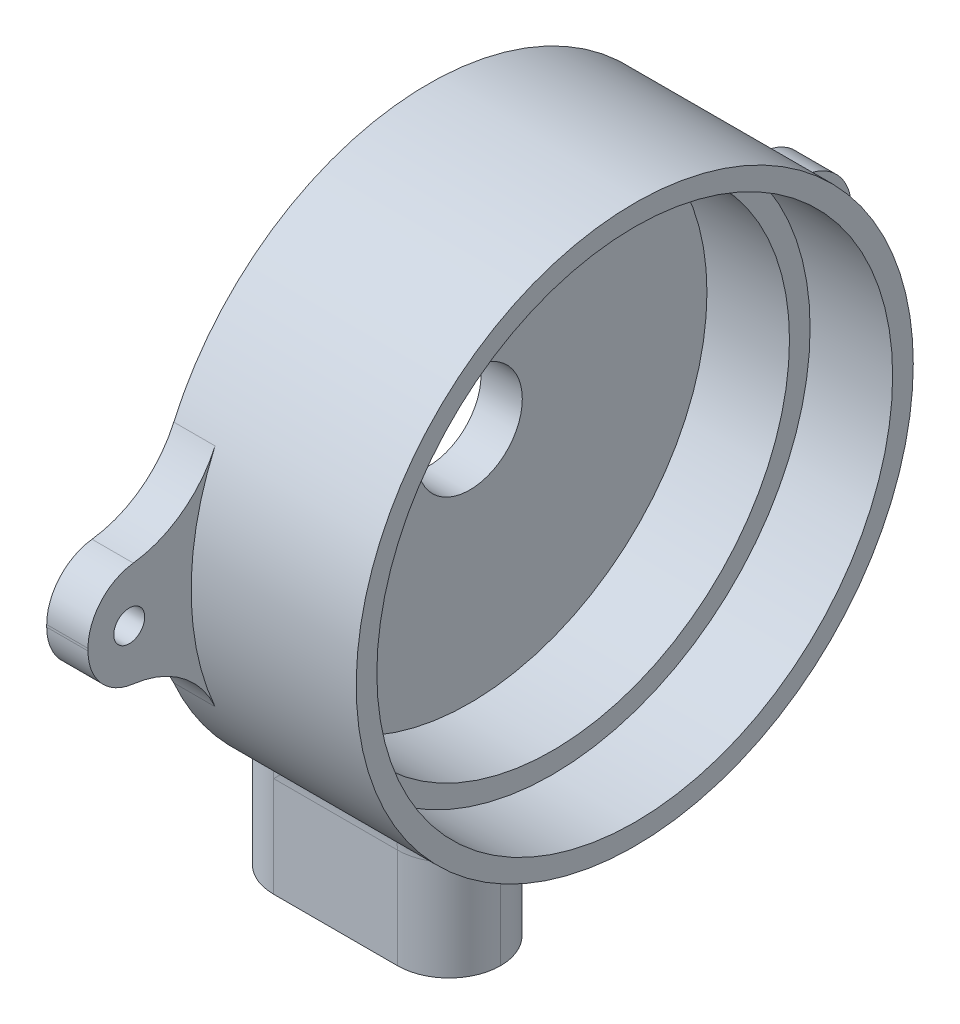
from build123d import *

# Parameters (mm, degrees)
SKETCH_1_R          = 27
EXTRUDE_1_DEPTH     = 20
EXTRUDE_2_DEPTH     = 4
SKETCH_2_R          = 25
CUT_EXTRUDE_1_DEPTH = 8
SKETCH_3_R          = 23
CUT_EXTRUDE_2_DEPTH = 8
CUT_EXTRUDE_5_REACH = 50.518
SKETCH_8_R          = 5.1
CUT_EXTRUDE_6_REACH = 50.518
SKETCH_11_R         = 1.5
FILLET_1_R          = 10
FILLET_2_R          = 5
SKETCH_12_W         = 10
SKETCH_12_H         = 5
EXTRUDE_3_DEPTH     = 15
SKETCH_13_W         = 22
SKETCH_13_H         = 10
EXTRUDE_4_DEPTH     = 17
FILLET_3_R          = 10
FILLET_START        = -21.532998323
FILLET_4_DEPTH      = 0.497094834
FILLET_START_2      = -21.035903489
FILLET_4_2_DEPTH    = 12.502905266
FILLET_START_3      = -37
FILLET_4_3_DEPTH    = 74
FILLET_START_4      = -5
FILLET_4_4_DEPTH    = 10
CUT_EXTRUDE_7_REACH = 84.121
SKETCH_14_R         = 3
FILLET_5_R          = 5


with BuildPart() as part:
    # 草图1 → 凸台-拉伸1 (new body)
    with BuildSketch(Plane(origin=(0, 0, 0), x_dir=(0, 0, -1), z_dir=(1, 0, 0))):
        Circle(SKETCH_1_R)
    extrude(amount=EXTRUDE_1_DEPTH)

    # 草图10 → 凸台-拉伸2 (add)
    with BuildSketch(Plane.ZY):
        Polygon((0, 5), (37, 5), (37, -5), (0, -5), (-37, -5), (-37, 5), align=None)
    extrude(amount=-EXTRUDE_2_DEPTH)

    # 草图2 → 切除-拉伸1 (cut)
    with BuildSketch(Plane(origin=(20, 0, 0), x_dir=(0, 0, -1), z_dir=(1, 0, 0))):
        Circle(SKETCH_2_R)
    extrude(amount=-CUT_EXTRUDE_1_DEPTH, mode=Mode.SUBTRACT)

    # 草图3 → 切除-拉伸2 (cut)
    with BuildSketch(Plane(origin=(12, 0, 0), x_dir=(0, 0, -1), z_dir=(1, 0, 0))):
        Circle(SKETCH_3_R)
    extrude(amount=-CUT_EXTRUDE_2_DEPTH, mode=Mode.SUBTRACT)

    # 草图8 → 切除-拉伸5 (cut, up to next)
    with BuildSketch(Plane(origin=(4, 0, 0), x_dir=(0, 0, -1), z_dir=(1, 0, 0)), mode=Mode.PRIVATE) as cut_extrude_5_sk1:
        Circle(SKETCH_8_R)
    cut_extrude_5_tool1 = extrude(cut_extrude_5_sk1.sketch, amount=-CUT_EXTRUDE_5_REACH, mode=Mode.PRIVATE) & part.part
    add(cut_extrude_5_tool1.solids().sort_by_distance((4, 0, 0))[0], mode=Mode.SUBTRACT)

    # 草图11 → 切除-拉伸6 (cut, up to next)
    with BuildSketch(Plane(origin=(4, 0, 0), x_dir=(0, 0, -1), z_dir=(1, 0, 0)), mode=Mode.PRIVATE) as cut_extrude_6_sk1:
        with Locations((-33, 0)):
            Circle(SKETCH_11_R)
    cut_extrude_6_tool1 = extrude(cut_extrude_6_sk1.sketch, amount=-CUT_EXTRUDE_6_REACH, mode=Mode.PRIVATE) & part.part
    # 草图11 → 切除-拉伸6 (cut, up to next)
    with BuildSketch(Plane(origin=(4, 0, 0), x_dir=(0, 0, -1), z_dir=(1, 0, 0)), mode=Mode.PRIVATE) as cut_extrude_6_sk2:
        with Locations((33, 0)):
            Circle(SKETCH_11_R)
    cut_extrude_6_tool2 = extrude(cut_extrude_6_sk2.sketch, amount=-CUT_EXTRUDE_6_REACH, mode=Mode.PRIVATE) & part.part
    add(cut_extrude_6_tool1.solids().sort_by_distance((4, 0, 33))[0], mode=Mode.SUBTRACT)
    add(cut_extrude_6_tool2.solids().sort_by_distance((4, 0, -33))[0], mode=Mode.SUBTRACT)

    # 圆角1
    fillet_1_edges = [part.edges().sort_by_distance(p)[0] for p in [
        (2, 5, -26.532998323),
        (2, 5, 26.532998323),
        (2, -5, 26.532998323),
        (2, -5, -26.532998323),
    ]]
    fillet(fillet_1_edges, radius=FILLET_1_R)

    # 圆角2
    fillet_2_edges = [part.edges().sort_by_distance(p)[0] for p in [
        (2, 5, 37),
        (2, -5, 37),
        (2, -5, -37),
        (2, 5, -37),
    ]]
    fillet(fillet_2_edges, radius=FILLET_2_R)

    # 草图12 → 凸台-拉伸3 (add)
    with BuildSketch(Plane.ZY):
        with Locations((0, -24.032998323)):
            Rectangle(SKETCH_12_W, SKETCH_12_H)
    extrude(amount=EXTRUDE_3_DEPTH)

    # 草图13 → 凸台-拉伸4 (add)
    with BuildSketch(Plane.XZ.offset(26.532998323)):
        with Locations((-4, 0)):
            Rectangle(SKETCH_13_W, SKETCH_13_H)
    extrude(amount=EXTRUDE_4_DEPTH)

    # 圆角3
    fillet_3_edges = [part.edges().sort_by_distance(p)[0] for p in [
        (0, -24.032998323, -5),
        (0, -24.032998323, 5),
        (3.5, -26.532998323, -5),
        (3.5, -26.532998323, 5),
    ]]
    fillet(fillet_3_edges, radius=FILLET_3_R)

    # 圆角4: read off the stored shape, not the designer's step
    # 圆角4 outline → 圆角4 (add)
    with BuildSketch(Plane(origin=(0, 0, 0), x_dir=(1, 0, 0), z_dir=(0, 1, 0)).offset(FILLET_START)):
        with BuildLine():
            Line((0, -15), (0, -5))
            Line((0, -5), (-10, -5))
            ThreePointArc((-10, -5), (-2.928932188, -7.928932188), (0, -15))
        make_face()
        with BuildLine():
            ThreePointArc((0, 15), (-2.928932188, 7.928932188), (-10, 5))
            Line((-10, 5), (0, 5))
            Line((0, 5), (0, 15))
        make_face()
    extrude(amount=FILLET_4_DEPTH)

    # Fillet 4 2 outline → Fillet 4 2 (add)
    with BuildSketch(Plane(origin=(0, 0, 0), x_dir=(1, 0, 0), z_dir=(0, 1, 0)).offset(FILLET_START_2)):
        with BuildLine():
            Line((0, -15), (0, -5))
            Line((0, -5), (-10, -5))
            ThreePointArc((-10, -5), (-2.928932188, -7.928932188), (0, -15))
        make_face()
        with BuildLine():
            ThreePointArc((0, 15), (-2.928932188, 7.928932188), (-10, 5))
            Line((-10, 5), (0, 5))
            Line((0, 5), (0, 15))
        make_face()
    extrude(amount=FILLET_4_2_DEPTH)

    # Fillet 4 3 outline → Fillet 4 3 (cut)
    with BuildSketch(Plane.XY.offset(FILLET_START_3)):
        with BuildLine():
            Line((-15, -21.532998323), (-13, -21.532998323))
            add(Edge.make_bspline(
                [(-13, -21.532998323), (0, -21.532998323), (0, -8.532998323)],
                knots=[0, 0, 0, 1, 1, 1], degree=2, weights=[1, 0.707106781, 1]))
            Line((0, -8.532998323), (0, -7))
            Line((0, -7), (-15, -7))
            Line((-15, -7), (-15, -21.532998323))
        make_face()
    extrude(amount=FILLET_4_3_DEPTH, mode=Mode.SUBTRACT)

    # Fillet 4 4 outline → Fillet 4 4 (add)
    with BuildSketch(Plane.XY.offset(FILLET_START_4)):
        with BuildLine():
            add(Edge.make_bspline(
                [(-13, -21.532998323), (0, -21.532998323), (0, -8.532998323)],
                knots=[0, 0, 0, 1, 1, 1], degree=2, weights=[1, 0.707106781, 1]))
            Line((-13, -21.532998323), (0, -21.532998323))
            Line((0, -21.532998323), (0, -8.532998323))
        make_face()
    extrude(amount=FILLET_4_4_DEPTH)

    # 草图14 → 切除-拉伸7 (cut, up to next)
    with BuildSketch(Plane(origin=(0, -43.532998323, 0), x_dir=(-1, 0, 0), z_dir=(0, -1, 0)), mode=Mode.PRIVATE) as cut_extrude_7_sk1:
        with Locations(Location((9, 0, 0), (0, 0, 90))):
            Circle(SKETCH_14_R)
    cut_extrude_7_tool1 = extrude(cut_extrude_7_sk1.sketch, amount=-CUT_EXTRUDE_7_REACH, mode=Mode.PRIVATE) & part.part
    add(cut_extrude_7_tool1.solids().sort_by_distance((-9, -43.532998, 0))[0], mode=Mode.SUBTRACT)

    # 圆角5
    # the kernel refuses this fillet: 5 mm, written as the material it takes off along each edge
    with BuildSketch(Plane(origin=(7, -33.823069051, -15), x_dir=(0, 0, 1), z_dir=(0, -1, 0))) as fillet_5_piece_1_section:
        with BuildLine():
            CenterArc((10 + FILLET_5_R, FILLET_5_R), FILLET_5_R, 180, 90)
            Line((10 + FILLET_5_R, 0), (10, 0))
            Line((10, 0), (10, FILLET_5_R))
        make_face()
    fillet_5_piece_1 = revolve(axis=Axis((7, -33.823069051, -15), (-1, 0, 0)), revolution_arc=137.718699106, mode=Mode.PRIVATE)
    fillet_5_piece_1 = fillet_5_piece_1 - Plane(origin=(7, 0, 0), x_dir=(0, 0, -1), z_dir=(-1, 0, 0)) * Cylinder(27, 60, mode=Mode.PRIVATE)
    add(fillet_5_piece_1, mode=Mode.SUBTRACT)
    with BuildSketch(Plane(origin=(7, -33.823069051, 15), x_dir=(0, 0, -1), z_dir=(0, -1, 0))) as fillet_5_piece_2_section:
        with BuildLine():
            CenterArc((10 + FILLET_5_R, -FILLET_5_R), FILLET_5_R, 90, 90)
            Line((10 + FILLET_5_R, 0), (10, 0))
            Line((10, 0), (10, -FILLET_5_R))
        make_face()
    fillet_5_piece_2 = revolve(axis=Axis((7, -33.823069051, 15), (1, 0, 0)), revolution_arc=137.718699106, mode=Mode.PRIVATE)
    fillet_5_piece_2 = fillet_5_piece_2 - Plane(origin=(7, 0, 0), x_dir=(0, 0, -1), z_dir=(-1, 0, 0)) * Cylinder(27, 60, mode=Mode.PRIVATE)
    add(fillet_5_piece_2, mode=Mode.SUBTRACT)
    with BuildSketch(Plane(origin=(7, -33.823069051, -5), x_dir=(-1, 0, 0), z_dir=(0, -1, 0))) as fillet_5_piece_3:
        with BuildLine():
            CenterArc((FILLET_5_R, -FILLET_5_R), FILLET_5_R, 90, 90)
            Line((0, -FILLET_5_R), (0, 0))
            Line((0, 0), (FILLET_5_R, 0))
        make_face()
    extrude(amount=22.209929272, mode=Mode.SUBTRACT)
    with BuildSketch(Plane(origin=(7, -33.823069051, 5), x_dir=(-1, 0, 0), z_dir=(0, -1, 0))) as fillet_5_piece_4:
        with BuildLine():
            CenterArc((FILLET_5_R, FILLET_5_R), FILLET_5_R, 180, 90)
            Line((0, FILLET_5_R), (0, 0))
            Line((0, 0), (FILLET_5_R, 0))
        make_face()
    extrude(amount=22.209929272, mode=Mode.SUBTRACT)
    with BuildSketch(Plane(origin=(-15, -9.032998323, 5), x_dir=(1, 0, 0), z_dir=(0, -1, 0)), Plane(origin=(-15, -56.032998323, -5), x_dir=(1, 0, 0), z_dir=(0, 1, 0))) as fillet_5_piece_5:
        with BuildLine():
            CenterArc((FILLET_5_R, -FILLET_5_R), FILLET_5_R, 90, 90)
            Line((0, -FILLET_5_R), (0, 0))
            Line((0, 0), (FILLET_5_R, 0))
        make_face()
    extrude(amount=47, mode=Mode.SUBTRACT)


solid = part.part
